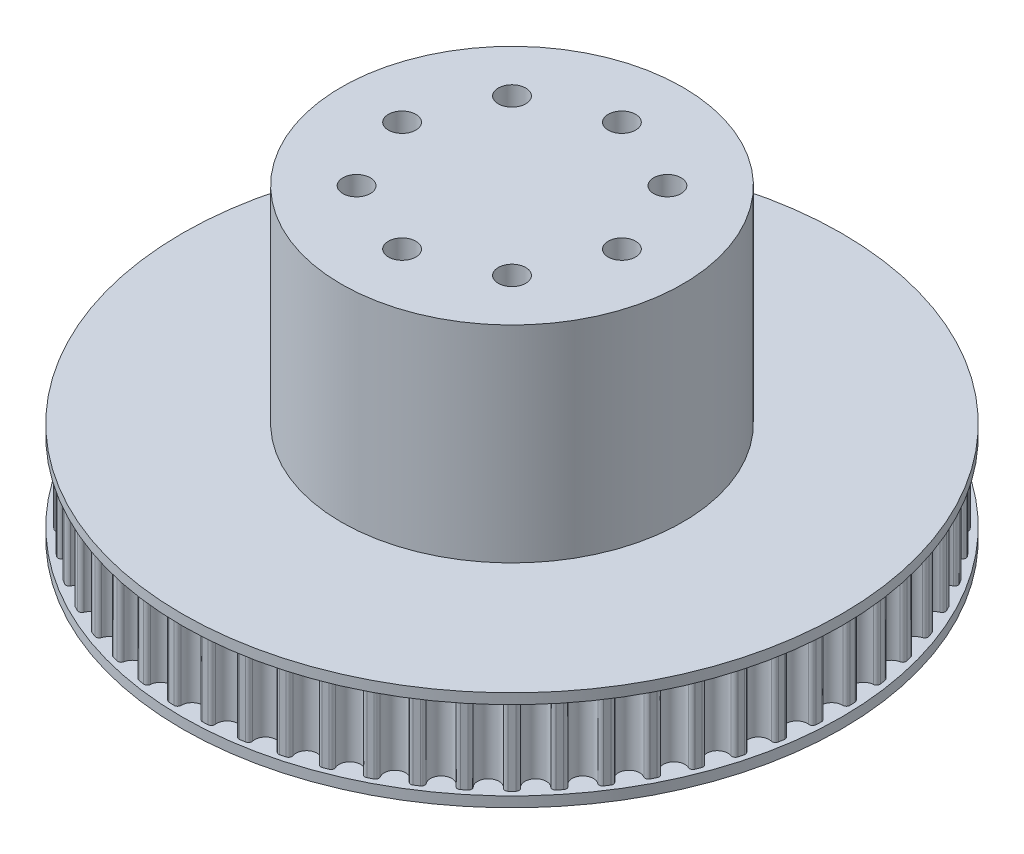
from build123d import *

# Parameters (mm, degrees)
SKETCH_1_R                       = 47.175
EXTRUDE_1_DEPTH                  = 11.5
CUT_EXTRUDE_1_DEPTH              = 68.699418387
FILLET_1_R                       = 0.5
PATTERN_CIRCULAR_1_COUNT         = 60
FILLET_1_OF_PATTERN_CIRCULAR_1_R = 0.5
SKETCH_5_R                       = 48
EXTRUDE_2_DEPTH                  = 1.5
SKETCH_6_R                       = 32.6
CUT_EXTRUDE_4_DEPTH              = 8.7
SKETCH_7_R                       = 34.1
CUT_EXTRUDE_5_DEPTH              = 1.7
EXTRUDE_START                    = 1.5
SKETCH_8_R                       = 48
EXTRUDE_3_DEPTH                  = 1.5
SKETCH_9_R                       = 22.5
CUT_EXTRUDE_7_DEPTH              = 2
SKETCH_10_R                      = 24.85
SKETCH_10_R_2                    = 19.85
EXTRUDE_4_DEPTH                  = 30
EXTRUDE_START_2                  = -3
SKETCH_11_R                      = 24.85
EXTRUDE_5_DEPTH                  = 3
SKETCH_12_R                      = 19.85
CUT_EXTRUDE_8_DEPTH              = 12
SKETCH_13_R                      = 2
CUT_EXTRUDE_9_DEPTH              = 80.562868344
PATTERN_CIRCULAR_2_COUNT         = 8


with BuildPart() as part:
    # 草图1 → 凸台-拉伸1 (new body)
    with BuildSketch(Plane(origin=(0, 0, 0), x_dir=(1, 0, 0), z_dir=(0, 1, 0))):
        Circle(SKETCH_1_R)
    extrude(amount=EXTRUDE_1_DEPTH)

    # 草图2 → 切除-拉伸1 (cut, through all)
    with BuildSketch(Plane(origin=(0, 11.5, 0), x_dir=(1, 0, 0), z_dir=(0, 1, 0))):
        with BuildLine():
            ThreePointArc((1.449074704, 47.15273913), (0, 47.175), (-1.449074704, 47.15273913))
            ThreePointArc((-1.449074704, 47.15273913), (0, 45.015), (1.449074704, 47.15273913))
        make_face()
    cut_extrude_1 = extrude(amount=-CUT_EXTRUDE_1_DEPTH, mode=Mode.SUBTRACT)

    # 圆角1
    fillet_1_edges = [part.edges().sort_by_distance(p)[0] for p in [
        (1.449074704, 5.75, -47.15273913),
        (-1.449074704, 5.75, -47.15273913),
    ]]
    fillet(fillet_1_edges, radius=FILLET_1_R)

    # 阵列(圆周)1: 切除-拉伸1 ×60 about axis
    pattern_circular_1_axis = Axis((0, 11.5, 0), (0, 1, 0))
    for i in range(1, PATTERN_CIRCULAR_1_COUNT):
        add(cut_extrude_1.rotate(pattern_circular_1_axis, i * 360 / PATTERN_CIRCULAR_1_COUNT), mode=Mode.SUBTRACT)

    # 圆角1 of 阵列(圆周)1
    fillet_1_of_pattern_circular_1_edges = [part.edges().sort_by_distance(p)[0] for p in [
        (-3.487666839, 5.75, -47.045901044),
        (-6.369939881, 5.75, -46.74296194),
        (-8.386196775, 5.75, -46.42361822),
        (-11.221014664, 5.75, -45.821059077),
        (-13.192845783, 5.75, -45.292708521),
        (-15.949149662, 5.75, -44.397131102),
        (-17.854951212, 5.75, -43.665562429),
        (-20.502542439, 5.75, -42.486778867),
        (-22.32143406, 5.75, -41.560007297),
        (-24.831305071, 5.75, -40.110932593),
        (-26.543358605, 5.75, -38.999112028),
        (-28.888010728, 5.75, -37.295622547),
        (-30.474468558, 5.75, -36.010934327),
        (-32.628213294, 5.75, -34.071693857),
        (-34.071693857, 5.75, -32.628213294),
        (-36.010934327, 5.75, -30.474468558),
        (-37.295622547, 5.75, -28.888010728),
        (-38.999112028, 5.75, -26.543358605),
        (-40.110932593, 5.75, -24.831305071),
        (-41.560007297, 5.75, -22.32143406),
        (-42.486778867, 5.75, -20.502542439),
        (-43.665562429, 5.75, -17.854951212),
        (-44.397131102, 5.75, -15.949149662),
        (-45.292708521, 5.75, -13.192845783),
        (-45.821059077, 5.75, -11.221014664),
        (-46.42361822, 5.75, -8.386196775),
        (-46.74296194, 5.75, -6.369939881),
        (-47.045901044, 5.75, -3.487666839),
        (-47.15273913, 5.75, -1.449074704),
        (-47.15273913, 5.75, 1.449074704),
        (-47.045901044, 5.75, 3.487666839),
        (-46.74296194, 5.75, 6.369939881),
        (-46.42361822, 5.75, 8.386196775),
        (-45.821059077, 5.75, 11.221014664),
        (-45.292708521, 5.75, 13.192845783),
        (-44.397131102, 5.75, 15.949149662),
        (-43.665562429, 5.75, 17.854951212),
        (-42.486778867, 5.75, 20.502542439),
        (-41.560007297, 5.75, 22.32143406),
        (-40.110932593, 5.75, 24.831305071),
        (-38.999112028, 5.75, 26.543358605),
        (-37.295622547, 5.75, 28.888010728),
        (-36.010934327, 5.75, 30.474468558),
        (-34.071693857, 5.75, 32.628213294),
        (-32.628213294, 5.75, 34.071693857),
        (-30.474468558, 5.75, 36.010934327),
        (-28.888010728, 5.75, 37.295622547),
        (-26.543358605, 5.75, 38.999112028),
        (-24.831305071, 5.75, 40.110932593),
        (-22.32143406, 5.75, 41.560007297),
        (-20.502542439, 5.75, 42.486778867),
        (-17.854951212, 5.75, 43.665562429),
        (-15.949149662, 5.75, 44.397131102),
        (-13.192845783, 5.75, 45.292708521),
        (-11.221014664, 5.75, 45.821059077),
        (-8.386196775, 5.75, 46.42361822),
        (-6.369939881, 5.75, 46.74296194),
        (-3.487666839, 5.75, 47.045901044),
        (-1.449074704, 5.75, 47.15273913),
        (1.449074704, 5.75, 47.15273913),
        (3.487666839, 5.75, 47.045901044),
        (6.369939881, 5.75, 46.74296194),
        (8.386196775, 5.75, 46.42361822),
        (11.221014664, 5.75, 45.821059077),
        (13.192845783, 5.75, 45.292708521),
        (15.949149662, 5.75, 44.397131102),
        (17.854951212, 5.75, 43.665562429),
        (20.502542439, 5.75, 42.486778867),
        (22.32143406, 5.75, 41.560007297),
        (24.831305071, 5.75, 40.110932593),
        (26.543358605, 5.75, 38.999112028),
        (28.888010728, 5.75, 37.295622547),
        (30.474468558, 5.75, 36.010934327),
        (32.628213294, 5.75, 34.071693857),
        (34.071693857, 5.75, 32.628213294),
        (36.010934327, 5.75, 30.474468558),
        (37.295622547, 5.75, 28.888010728),
        (38.999112028, 5.75, 26.543358605),
        (40.110932593, 5.75, 24.831305071),
        (41.560007297, 5.75, 22.32143406),
        (42.486778867, 5.75, 20.502542439),
        (43.665562429, 5.75, 17.854951212),
        (44.397131102, 5.75, 15.949149662),
        (45.292708521, 5.75, 13.192845783),
        (45.821059077, 5.75, 11.221014664),
        (46.42361822, 5.75, 8.386196775),
        (46.74296194, 5.75, 6.369939881),
        (47.045901044, 5.75, 3.487666839),
        (47.15273913, 5.75, 1.449074704),
        (47.15273913, 5.75, -1.449074704),
        (47.045901044, 5.75, -3.487666839),
        (46.74296194, 5.75, -6.369939881),
        (46.42361822, 5.75, -8.386196775),
        (45.821059077, 5.75, -11.221014664),
        (45.292708521, 5.75, -13.192845783),
        (44.397131102, 5.75, -15.949149662),
        (43.665562429, 5.75, -17.854951212),
        (42.486778867, 5.75, -20.502542439),
        (41.560007297, 5.75, -22.32143406),
        (40.110932593, 5.75, -24.831305071),
        (38.999112028, 5.75, -26.543358605),
        (37.295622547, 5.75, -28.888010728),
        (36.010934327, 5.75, -30.474468558),
        (34.071693857, 5.75, -32.628213294),
        (32.628213294, 5.75, -34.071693857),
        (30.474468558, 5.75, -36.010934327),
        (28.888010728, 5.75, -37.295622547),
        (26.543358605, 5.75, -38.999112028),
        (24.831305071, 5.75, -40.110932593),
        (22.32143406, 5.75, -41.560007297),
        (20.502542439, 5.75, -42.486778867),
        (17.854951212, 5.75, -43.665562429),
        (15.949149662, 5.75, -44.397131102),
        (13.192845783, 5.75, -45.292708521),
        (11.221014664, 5.75, -45.821059077),
        (8.386196775, 5.75, -46.42361822),
        (6.369939881, 5.75, -46.74296194),
        (3.487666839, 5.75, -47.045901044),
    ]]
    fillet(fillet_1_of_pattern_circular_1_edges, radius=FILLET_1_OF_PATTERN_CIRCULAR_1_R)

    # 草图5 → 凸台-拉伸2 (add)
    with BuildSketch(Plane.XZ):
        Circle(SKETCH_5_R)
    extrude(amount=EXTRUDE_2_DEPTH)

    # 草图6 → 切除-拉伸4 (cut)
    with BuildSketch(Plane.XZ.offset(1.5)):
        Circle(SKETCH_6_R)
    extrude(amount=-CUT_EXTRUDE_4_DEPTH, mode=Mode.SUBTRACT)

    # 草图7 → 切除-拉伸5 (cut)
    with BuildSketch(Plane.XZ.offset(1.5)):
        Circle(SKETCH_7_R)
    extrude(amount=-CUT_EXTRUDE_5_DEPTH, mode=Mode.SUBTRACT)

    # 草图8 → 凸台-拉伸3 (add)
    with BuildSketch(Plane(origin=(0, 11.5, 0), x_dir=(1, 0, 0), z_dir=(0, 1, 0)).offset(EXTRUDE_START)):
        Circle(SKETCH_8_R)
    extrude(amount=-EXTRUDE_3_DEPTH)

    # 草图9 → 切除-拉伸7 (cut)
    with BuildSketch(Plane.XZ.offset(-7.2)):
        Circle(SKETCH_9_R)
    extrude(amount=-CUT_EXTRUDE_7_DEPTH, mode=Mode.SUBTRACT)

    # 草图10 → 凸台-拉伸4 (add)
    with BuildSketch(Plane(origin=(0, 13, 0), x_dir=(1, 0, 0), z_dir=(0, 1, 0))):
        Circle(SKETCH_10_R)
        Circle(SKETCH_10_R_2, mode=Mode.SUBTRACT)
    extrude(amount=EXTRUDE_4_DEPTH)

    # 草图11 → 凸台-拉伸5 (add)
    with BuildSketch(Plane(origin=(0, 43, 0), x_dir=(1, 0, 0), z_dir=(0, 1, 0)).offset(EXTRUDE_START_2)):
        Circle(SKETCH_11_R)
    extrude(amount=EXTRUDE_5_DEPTH)

    # 草图12 → 切除-拉伸8 (cut)
    with BuildSketch(Plane.XZ.offset(-9.2)):
        Circle(SKETCH_12_R)
    extrude(amount=-CUT_EXTRUDE_8_DEPTH, mode=Mode.SUBTRACT)

    # 草图13 → 切除-拉伸9 (cut, through all)
    with BuildSketch(Plane.XZ.offset(-40)):
        with Locations((0, -16)):
            Circle(SKETCH_13_R)
    cut_extrude_9 = extrude(amount=-CUT_EXTRUDE_9_DEPTH, mode=Mode.SUBTRACT)

    # 阵列(圆周)2: 切除-拉伸9 ×8 about axis
    pattern_circular_2_axis = Axis((0, 43, 0), (0, -1, 0))
    for i in range(1, PATTERN_CIRCULAR_2_COUNT):
        add(cut_extrude_9.rotate(pattern_circular_2_axis, i * 360 / PATTERN_CIRCULAR_2_COUNT), mode=Mode.SUBTRACT)


solid = part.part
